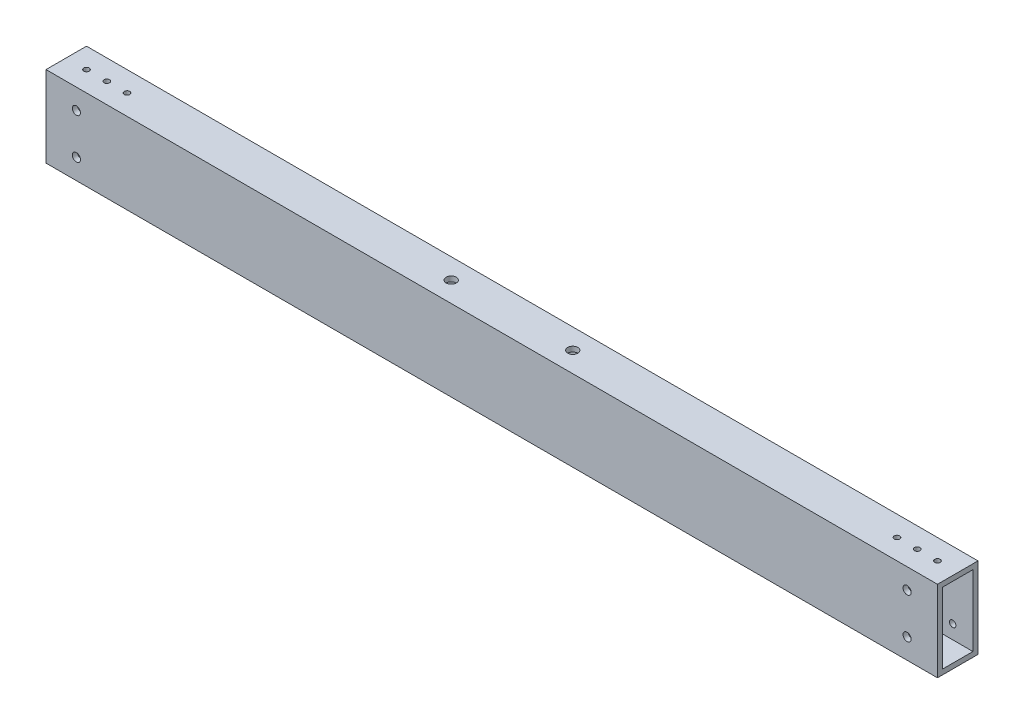
from build123d import *

# Parameters (mm, degrees)
SKETCH1_W                   = 558.8
SKETCH1_H                   = 50.8
BOSS_EXTRUDE1_DEPTH         = 12.7
SKETCH2_W                   = 19.05
SKETCH2_H                   = 44.45
CUT_EXTRUDE1_DEPTH          = 560.521125607
SKETCH4_R                   = 1.7272
CUT_EXTRUDE2_DEPTH          = 6.35
F_1_4_20_TAPPED_HOLE1_D     = 5.1054
F_1_4_20_TAPPED_HOLE1_DEPTH = 5.08
F_1_4_20_TAPPED_HOLE1_TIP   = 1.533816902
F_10_32_TAPPED_HOLE1_D      = 4.0386
F_10_32_TAPPED_HOLE1_DEPTH  = 5.08
F_10_32_TAPPED_HOLE1_TIP    = 1.213317848
F_1_4_0_25_DIAMETER_HOLE1_D = 6.35


with BuildPart() as part:
    # Sketch1 → Boss-Extrude1 (new, symmetric)
    with BuildSketch(Plane.XY):
        Rectangle(SKETCH1_W, SKETCH1_H)
    extrude(amount=BOSS_EXTRUDE1_DEPTH, both=True)

    # Sketch2 → Cut-Extrude1 (cut, through all)
    with BuildSketch(Plane(origin=(279.4, 0, 0), x_dir=(0, 0, -1), z_dir=(1, 0, 0))):
        Rectangle(SKETCH2_W, SKETCH2_H)
    extrude(amount=-CUT_EXTRUDE1_DEPTH, mode=Mode.SUBTRACT)

    # Sketch4 → Cut-Extrude2 (cut)
    with BuildSketch(Plane(origin=(0, 25.4, 0), x_dir=(1, 0, 0), z_dir=(0, 1, 0))):
        with Locations((-304.8, 0)):
            Circle(SKETCH4_R)
        with Locations((-292.1, 0)):
            Circle(SKETCH4_R)
        with Locations((-266.7, 0)):
            Circle(SKETCH4_R)
        with Locations((-254, 0)):
            Circle(SKETCH4_R)
        with Locations((-241.3, 0)):
            Circle(SKETCH4_R)
        with Locations((241.3, 0)):
            Circle(SKETCH4_R)
        with Locations((254, 0)):
            Circle(SKETCH4_R)
        with Locations((266.7, 0)):
            Circle(SKETCH4_R)
    extrude(amount=-CUT_EXTRUDE2_DEPTH, mode=Mode.SUBTRACT)

    # 1/4-20 Tapped Hole1
    with Locations(Plane.XY.offset(12.7)):
        with Locations((-260.35, 12.7), (-260.35, -12.7), (260.35, 12.7), (260.35, -12.7)):
            Hole(F_1_4_20_TAPPED_HOLE1_D / 2, depth=F_1_4_20_TAPPED_HOLE1_DEPTH)
            with Locations((0, 0, -(F_1_4_20_TAPPED_HOLE1_DEPTH + F_1_4_20_TAPPED_HOLE1_TIP / 2))):  # 118° drill point
                Cone(0, F_1_4_20_TAPPED_HOLE1_D / 2, F_1_4_20_TAPPED_HOLE1_TIP, mode=Mode.SUBTRACT)

    # #10-32 Tapped Hole1
    with Locations(Plane(origin=(0, 0, -12.7), x_dir=(-1, 0, 0), z_dir=(0, 0, -1))):
        with Locations((-266.7, -13.49375), (-190.5, -13.49375), (-114.3, -13.49375), (-38.1, -13.49375), (38.1, -13.49375), (114.3, -13.49375), (190.5, -13.49375), (266.7, -13.49375)):
            Hole(F_10_32_TAPPED_HOLE1_D / 2, depth=F_10_32_TAPPED_HOLE1_DEPTH)
            with Locations((0, 0, -(F_10_32_TAPPED_HOLE1_DEPTH + F_10_32_TAPPED_HOLE1_TIP / 2))):  # 118° drill point
                Cone(0, F_10_32_TAPPED_HOLE1_D / 2, F_10_32_TAPPED_HOLE1_TIP, mode=Mode.SUBTRACT)

    # 1/4 (0.25) Diameter Hole1 (through all)
    with Locations(Plane(origin=(0, 25.4, 0), x_dir=(1, 0, 0), z_dir=(0, 1, 0))):
        with Locations((-38.1, 0), (38.1, 0)):
            Hole(F_1_4_0_25_DIAMETER_HOLE1_D / 2)


solid = part.part
